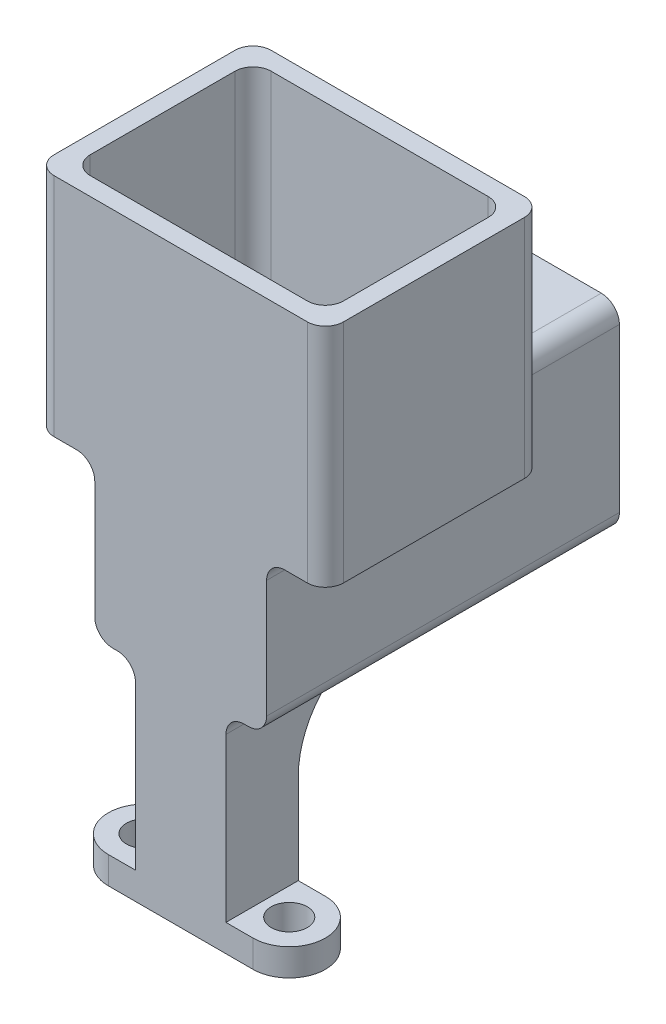
from build123d import *

# Parameters (mm, degrees)
SKETCH_1_R          = 2
EXTRUDE_1_DEPTH     = 3
SKETCH_2_W          = 10
SKETCH_2_H          = 8
EXTRUDE_2_DEPTH     = 20
SKETCH_3_W          = 19
SKETCH_3_H          = 39
EXTRUDE_3_DEPTH     = 22
SKETCH_4_W          = 15
SKETCH_4_H          = 18
CUT_EXTRUDE_1_DEPTH = 31
SKETCH_5_W          = 15
SKETCH_5_H          = 8
CUT_EXTRUDE_2_DEPTH = 5
SKETCH_6_W          = 32
SKETCH_6_H          = 24
EXTRUDE_5_DEPTH     = 20
SKETCH_7_W          = 28
SKETCH_7_H          = 20
CUT_EXTRUDE_3_DEPTH = 20
SKETCH_8_W          = 6.5
SKETCH_8_H          = 24
EXTRUDE_6_DEPTH     = 5
SKETCH_9_W          = 15
SKETCH_9_H          = 10
EXTRUDE_7_DEPTH     = 2
FILLET_1_R          = 2
FILLET_2_R          = 2
FILLET_3_R          = 2
FILLET_4_R          = 2
FILLET_5_R          = 2
FILLET_6_R          = 2
FILLET_7_R          = 2
FILLET_8_R          = 2
FILLET_9_R          = 2
FILLET_10_R         = 2
FILLET_11_R         = 2
FILLET_12_R         = 2
FILLET_13_R         = 2
FILLET_14_R         = 2
FILLET_15_R         = 2
FILLET_16_R         = 2
FILLET_17_R         = 2
FILLET_18_R         = 2
FILLET_19_R         = 2
FILLET_20_R         = 2
FILLET_START        = -5
FILLET_21_DEPTH     = 10
FILLET_START_2      = -14
FILLET_21_2_DEPTH   = 10
FILLET_START_3      = -8
FILLET_21_3_DEPTH   = 16


with BuildPart() as part:
    # 草图1 → 凸台-拉伸1 (new body)
    with BuildSketch(Plane(origin=(0, 0, 0), x_dir=(1, 0, 0), z_dir=(0, 1, 0))):
        with BuildLine():
            Line((-8, 4), (8, 4))
            ThreePointArc((8, 4), (12, 0), (8, -4))
            Line((8, -4), (-8, -4))
            ThreePointArc((-8, -4), (-12, 0), (-8, 4))
        make_face()
        with Locations(Location((8, 0, 0), (0, 0, 270))):
            Circle(SKETCH_1_R, mode=Mode.SUBTRACT)
        with Locations(Location((-8, 0, 0), (0, 0, 270))):
            Circle(SKETCH_1_R, mode=Mode.SUBTRACT)
    extrude(amount=EXTRUDE_1_DEPTH)

    # 草图2 → 凸台-拉伸2 (add)
    with BuildSketch(Plane(origin=(0, 3, 0), x_dir=(1, 0, 0), z_dir=(0, 1, 0))):
        Rectangle(SKETCH_2_W, SKETCH_2_H)
    extrude(amount=EXTRUDE_2_DEPTH)

    # 草图3 → 凸台-拉伸3 (add)
    with BuildSketch(Plane(origin=(0, 23, 0), x_dir=(1, 0, 0), z_dir=(0, 1, 0))):
        with Locations((0, 15.5)):
            Rectangle(SKETCH_3_W, SKETCH_3_H)
    extrude(amount=EXTRUDE_3_DEPTH)

    # 草图4 → 切除-拉伸1 (cut)
    with BuildSketch(Plane(origin=(0, 0, -35), x_dir=(-1, 0, 0), z_dir=(0, 0, -1))):
        with Locations((0, 34)):
            Rectangle(SKETCH_4_W, SKETCH_4_H)
    extrude(amount=-CUT_EXTRUDE_1_DEPTH, mode=Mode.SUBTRACT)

    # 草图5 → 切除-拉伸2 (cut)
    with BuildSketch(Plane(origin=(0, 45, 0), x_dir=(1, 0, 0), z_dir=(0, 1, 0))):
        with Locations((0, 8)):
            Rectangle(SKETCH_5_W, SKETCH_5_H)
    extrude(amount=-CUT_EXTRUDE_2_DEPTH, mode=Mode.SUBTRACT)

    # 草图6 → 凸台-拉伸5 (add)
    with BuildSketch(Plane(origin=(0, 45, 0), x_dir=(1, 0, 0), z_dir=(0, 1, 0))):
        with Locations((0, 8)):
            Rectangle(SKETCH_6_W, SKETCH_6_H)
    extrude(amount=EXTRUDE_5_DEPTH)

    # 草图7 → 切除-拉伸3 (cut)
    with BuildSketch(Plane(origin=(0, 65, 0), x_dir=(1, 0, 0), z_dir=(0, 1, 0))):
        with Locations((0, 8)):
            Rectangle(SKETCH_7_W, SKETCH_7_H)
    extrude(amount=-CUT_EXTRUDE_3_DEPTH, mode=Mode.SUBTRACT)

    # 草图8 → 凸台-拉伸6 (add)
    with BuildSketch(Plane(origin=(0, 45, 0), x_dir=(1, 0, 0), z_dir=(0, 1, 0))):
        Polygon((-16, 20), (-16, -4), (-9.5, -4), (-9.5, -2), (-9.5, 18), (-9.5, 20), align=None)
        with Locations((12.75, 8)):
            Rectangle(SKETCH_8_W, SKETCH_8_H)
    extrude(amount=-EXTRUDE_6_DEPTH)

    # 草图9 → 凸台-拉伸7 (add)
    with BuildSketch(Plane(origin=(0, 25, 0), x_dir=(1, 0, 0), z_dir=(0, 1, 0))):
        with Locations((0, 9)):
            Rectangle(SKETCH_9_W, SKETCH_9_H)
    extrude(amount=EXTRUDE_7_DEPTH)

    # 圆角1
    fillet_1_edges = [part.edges().sort_by_distance(p)[0] for p in [
        (16, 52.5, -20),
    ]]
    fillet(fillet_1_edges, radius=FILLET_1_R)

    # 圆角2
    fillet_2_edges = [part.edges().sort_by_distance(p)[0] for p in [
        (-16, 52.5, -20),
    ]]
    fillet(fillet_2_edges, radius=FILLET_2_R)

    # 圆角3
    fillet_3_edges = [part.edges().sort_by_distance(p)[0] for p in [
        (-16, 52.5, 4),
    ]]
    fillet(fillet_3_edges, radius=FILLET_3_R)

    # 圆角4
    fillet_4_edges = [part.edges().sort_by_distance(p)[0] for p in [
        (16, 52.5, 4),
    ]]
    fillet(fillet_4_edges, radius=FILLET_4_R)

    # 圆角5
    fillet_5_edges = [part.edges().sort_by_distance(p)[0] for p in [
        (14, 55, 2),
    ]]
    fillet(fillet_5_edges, radius=FILLET_5_R)

    # 圆角6
    fillet_6_edges = [part.edges().sort_by_distance(p)[0] for p in [
        (-14, 55, 2),
    ]]
    fillet(fillet_6_edges, radius=FILLET_6_R)

    # 圆角7
    fillet_7_edges = [part.edges().sort_by_distance(p)[0] for p in [
        (-14, 55, -18),
    ]]
    fillet(fillet_7_edges, radius=FILLET_7_R)

    # 圆角8
    fillet_8_edges = [part.edges().sort_by_distance(p)[0] for p in [
        (14, 55, -18),
    ]]
    fillet(fillet_8_edges, radius=FILLET_8_R)

    # 圆角9
    fillet_9_edges = [part.edges().sort_by_distance(p)[0] for p in [
        (-7.5, 36, -4),
    ]]
    fillet(fillet_9_edges, radius=FILLET_9_R)

    # 圆角10
    fillet_10_edges = [part.edges().sort_by_distance(p)[0] for p in [
        (7.5, 36, -4),
    ]]
    fillet(fillet_10_edges, radius=FILLET_10_R)

    # 圆角11
    fillet_11_edges = [part.edges().sort_by_distance(p)[0] for p in [
        (7.5, 44, -12),
    ]]
    fillet(fillet_11_edges, radius=FILLET_11_R)

    # 圆角12
    fillet_12_edges = [part.edges().sort_by_distance(p)[0] for p in [
        (-7.5, 44, -12),
    ]]
    fillet(fillet_12_edges, radius=FILLET_12_R)

    # 圆角13
    fillet_13_edges = [part.edges().sort_by_distance(p)[0] for p in [
        (-9.5, 45, -27.5),
    ]]
    fillet(fillet_13_edges, radius=FILLET_13_R)

    # 圆角14
    fillet_14_edges = [part.edges().sort_by_distance(p)[0] for p in [
        (9.5, 45, -27.5),
    ]]
    fillet(fillet_14_edges, radius=FILLET_14_R)

    # 圆角15
    fillet_15_edges = [part.edges().sort_by_distance(p)[0] for p in [
        (9.5, 23, -15.5),
    ]]
    fillet(fillet_15_edges, radius=FILLET_15_R)

    # 圆角16
    fillet_16_edges = [part.edges().sort_by_distance(p)[0] for p in [
        (-9.5, 23, -15.5),
    ]]
    fillet(fillet_16_edges, radius=FILLET_16_R)

    # 圆角17
    fillet_17_edges = [part.edges().sort_by_distance(p)[0] for p in [
        (9.5, 40, -8),
    ]]
    fillet(fillet_17_edges, radius=FILLET_17_R)

    # 圆角18
    fillet_18_edges = [part.edges().sort_by_distance(p)[0] for p in [
        (-9.5, 40, -8),
    ]]
    fillet(fillet_18_edges, radius=FILLET_18_R)

    # 圆角19
    fillet_19_edges = [part.edges().sort_by_distance(p)[0] for p in [
        (5, 23, 0),
    ]]
    fillet(fillet_19_edges, radius=FILLET_19_R)

    # 圆角20
    fillet_20_edges = [part.edges().sort_by_distance(p)[0] for p in [
        (-5, 23, 0),
    ]]
    fillet(fillet_20_edges, radius=FILLET_20_R)

    # 圆角21: read off the stored shape, not the designer's step
    # 圆角21 outline → 圆角21 (add)
    with BuildSketch(Plane.YZ.offset(FILLET_START)):
        with BuildLine():
            Line((23, -4), (13, -4))
            ThreePointArc((13, -4), (20.071068, -6.928932), (23, -14))
            Line((23, -14), (23, -4))
        make_face()
    extrude(amount=FILLET_21_DEPTH)

    # Fillet 21 2 outline → Fillet 21 2 (add)
    with BuildSketch(Plane.XY.offset(FILLET_START_2)):
        with BuildLine():
            Line((5, 23), (5, 21))
            ThreePointArc((5, 21), (5.585786, 22.414214), (7, 23))
            Line((7, 23), (5, 23))
        make_face()
        with BuildLine():
            Line((-5, 21), (-5, 23))
            Line((-5, 23), (-7, 23))
            ThreePointArc((-7, 23), (-5.585786, 22.414214), (-5, 21))
        make_face()
    extrude(amount=FILLET_21_2_DEPTH)

    # Fillet 21 3 outline → Fillet 21 3 (cut)
    with BuildSketch(Plane.YZ.offset(FILLET_START_3)):
        with BuildLine():
            Line((21, -14), (23, -14))
            ThreePointArc((23, -14), (22.486833, -10.837722), (21, -8))
            Line((21, -8), (21, -14))
        make_face()
    extrude(amount=FILLET_21_3_DEPTH, mode=Mode.SUBTRACT)


solid = part.part
